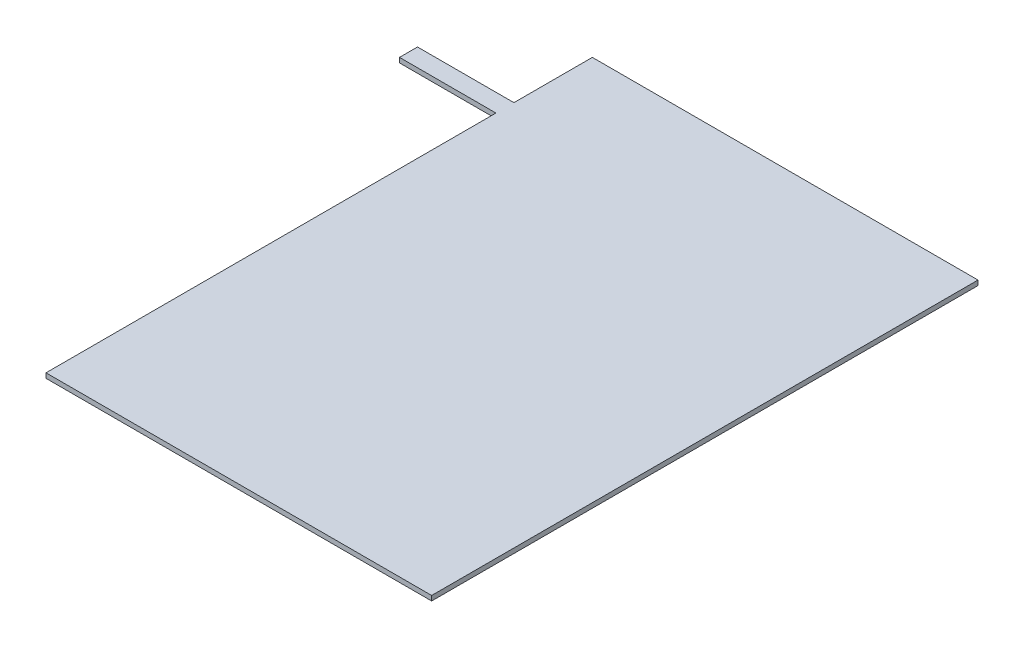
from build123d import *

# Parameters (mm, degrees)
BOSS_EXTRUDE2_DEPTH = 1.905


with BuildPart() as part:
    # Sketch3 → Boss-Extrude2 (new body)
    with BuildSketch(Plane(origin=(0, 0, 0), x_dir=(1, 0, 0), z_dir=(0, 1, 0))):
        Polygon((165.1, 215.9), (12.7, 215.9), (12.7, 184.912), (-25.4, 184.912), (-25.4, 177.8), (12.7, 177.8), (12.7, 0), (165.1, 0), align=None)
    extrude(amount=BOSS_EXTRUDE2_DEPTH)


solid = part.part
